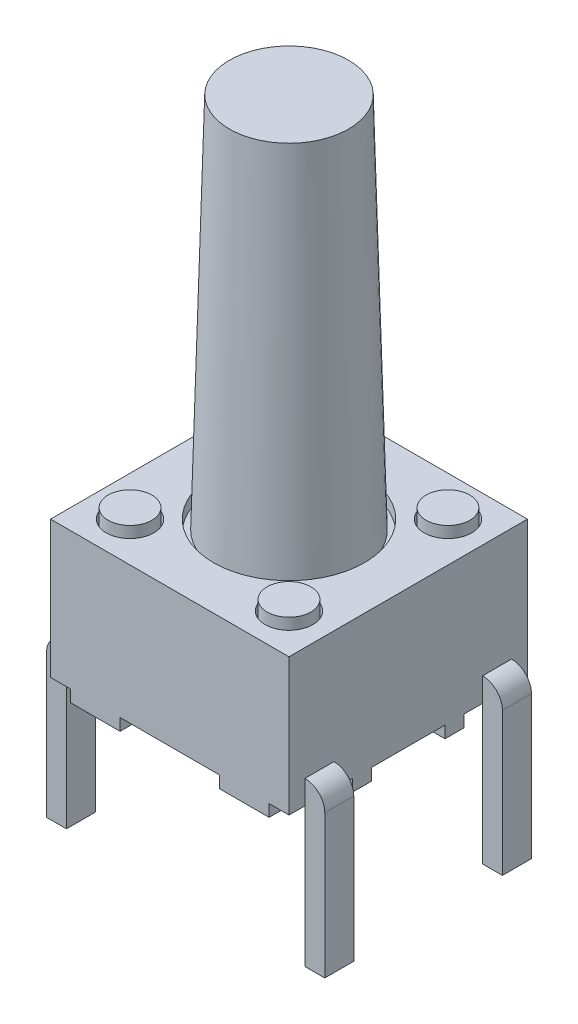
from build123d import *

# Parameters (mm, degrees)
SKETCH1_W                  = 6
SKETCH1_H                  = 6
BOSS_EXTRUDE1_DEPTH        = 3.45
SKETCH2_W                  = 6
SKETCH2_H                  = 6
SKETCH2_R                  = 0.6
SKETCH2_R_2                = 1.9
BOSS_EXTRUDE2_DEPTH        = 0.3
SKETCH3_R                  = 0.55
BOSS_EXTRUDE3_DEPTH        = 0.55
SKETCH5_W                  = 2.5
SKETCH5_H                  = 1.6
SKETCH5_W_2                = 6
SKETCH5_H_2                = 1.85
SKETCH5_W_3                = 0.5
CUT_EXTRUDE1_DEPTH         = 0.3
BOSS_EXTRUDE4_DEPTH        = 3.5
BOSS_EXTRUDE4_DEPTH_BACK   = 0.6
SKETCH6_W                  = 0.5
SKETCH6_H                  = 0.73
BOSS_EXTRUDE4_2_DEPTH      = 3.5
BOSS_EXTRUDE4_2_DEPTH_BACK = 0.6
BOSS_EXTRUDE4_3_DEPTH      = 3.5
BOSS_EXTRUDE4_3_DEPTH_BACK = 0.6
BOSS_EXTRUDE4_4_DEPTH      = 3.5
BOSS_EXTRUDE4_4_DEPTH_BACK = 0.6
FILLET1_R                  = 0.5
FILLET2_R                  = 0.5
FILLET3_R                  = 0.5
FILLET4_R                  = 0.5


with BuildPart() as part:
    # Sketch1 → Boss-Extrude1 (new body)
    with BuildSketch(Plane(origin=(0, 0, 0), x_dir=(1, 0, 0), z_dir=(0, 1, 0))):
        Rectangle(SKETCH1_W, SKETCH1_H)
    extrude(amount=BOSS_EXTRUDE1_DEPTH)



with BuildPart() as body_2:
    # Sketch2 → Boss-Extrude2 (new body)
    with BuildSketch(Plane(origin=(0, 3.45, 0), x_dir=(1, 0, 0), z_dir=(0, 1, 0))):
        Rectangle(SKETCH2_W, SKETCH2_H)
        with Locations(Location((-2, 2, 0), (0, 0, 270))):
            Circle(SKETCH2_R, mode=Mode.SUBTRACT)
        with Locations(Location((2, 2, 0), (0, 0, 270))):
            Circle(SKETCH2_R, mode=Mode.SUBTRACT)
        with Locations(Location((2, -2, 0), (0, 0, 270))):
            Circle(SKETCH2_R, mode=Mode.SUBTRACT)
        with Locations(Location((-2, -2, 0), (0, 0, 270))):
            Circle(SKETCH2_R, mode=Mode.SUBTRACT)
        with Locations(Location((0, 0, 0), (0, 0, 270))):
            Circle(SKETCH2_R_2, mode=Mode.SUBTRACT)
    extrude(amount=BOSS_EXTRUDE2_DEPTH)


with BuildPart() as part_1:
    add(part.part)

    add(body_2.part)  # Boss-Extrude3 merges body 2
    # Sketch3 → Boss-Extrude3 (add)
    with BuildSketch(Plane(origin=(0, 3.45, 0), x_dir=(1, 0, 0), z_dir=(0, 1, 0))):
        with Locations(Location((-2, 2, 0), (0, 0, 270))):
            Circle(SKETCH3_R)
        with Locations(Location((-2, -2, 0), (0, 0, 270))):
            Circle(SKETCH3_R)
        with Locations(Location((2, 2, 0), (0, 0, 270))):
            Circle(SKETCH3_R)
        with Locations(Location((2, -2, 0), (0, 0, 270))):
            Circle(SKETCH3_R)
    extrude(amount=BOSS_EXTRUDE3_DEPTH)

    # Sketch5 → Cut-Extrude1 (cut)
    with BuildSketch(Plane.XZ):
        with Locations((0, 2.2)):
            Rectangle(SKETCH5_W, SKETCH5_H)
        Rectangle(SKETCH5_W_2, SKETCH5_H_2)
        with Locations((-2.75, 2.2)):
            Rectangle(SKETCH5_W_3, SKETCH5_H)
        with Locations((2.75, 2.2)):
            Rectangle(SKETCH5_W_3, SKETCH5_H)
        with Locations((2.75, -2.2)):
            Rectangle(SKETCH5_W_3, SKETCH5_H)
        with Locations((-2.75, -2.2)):
            Rectangle(SKETCH5_W_3, SKETCH5_H)
        with Locations((0, -2.2)):
            Rectangle(SKETCH5_W, SKETCH5_H)
    extrude(amount=-CUT_EXTRUDE1_DEPTH, mode=Mode.SUBTRACT)


with BuildPart() as body_2_2:
    # Sketch4 → Revolve1 (revolve)
    with BuildSketch(Plane.XY, mode=Mode.PRIVATE) as revolve1_sk:
        Polygon((0, 13), (-1.5, 13), (-1.75, 3.506112458), (0, 3.506112458), align=None)
    revolve(revolve1_sk.sketch.rotate(Axis((0, 0, 0), (0, 1, 0)), 270), axis=Axis((0, 0, 0), (0, 1, 0)))


with BuildPart() as body_3:
    # Sketch6 → Boss-Extrude4 (new, two sides: drawn at the far end of the back side and taken through both)
    with BuildSketch(Plane.XZ.offset(-0.3).offset(-BOSS_EXTRUDE4_DEPTH_BACK)):
        with Locations((-3.25, 2.235)):
            Rectangle(SKETCH6_W, SKETCH6_H)
    extrude(amount=BOSS_EXTRUDE4_DEPTH + BOSS_EXTRUDE4_DEPTH_BACK)

    # Fillet1
    fillet1_edges = [body_3.edges().sort_by_distance(p)[0] for p in [
        (-3.5, 0.9, 2.235),
    ]]
    fillet(fillet1_edges, radius=FILLET1_R - 0.0001)  # a hair under: the kernel refuses the full size


with BuildPart() as body_4:
    # Sketch6 → Boss-Extrude4 2 (new, two sides: drawn at the far end of the back side and taken through both)
    with BuildSketch(Plane.XZ.offset(-0.3).offset(-BOSS_EXTRUDE4_2_DEPTH_BACK)):
        with Locations((3.25, 2.235)):
            Rectangle(SKETCH6_W, SKETCH6_H)
    extrude(amount=BOSS_EXTRUDE4_2_DEPTH + BOSS_EXTRUDE4_2_DEPTH_BACK)

    # Fillet3
    fillet3_edges = [body_4.edges().sort_by_distance(p)[0] for p in [
        (3.5, 0.9, 2.235),
    ]]
    fillet(fillet3_edges, radius=FILLET3_R - 0.0001)  # a hair under: the kernel refuses the full size


with BuildPart() as body_5:
    # Sketch6 → Boss-Extrude4 3 (new, two sides: drawn at the far end of the back side and taken through both)
    with BuildSketch(Plane.XZ.offset(-0.3).offset(-BOSS_EXTRUDE4_3_DEPTH_BACK)):
        with Locations((3.25, -2.235)):
            Rectangle(SKETCH6_W, SKETCH6_H)
    extrude(amount=BOSS_EXTRUDE4_3_DEPTH + BOSS_EXTRUDE4_3_DEPTH_BACK)

    # Fillet4
    fillet4_edges = [body_5.edges().sort_by_distance(p)[0] for p in [
        (3.5, 0.9, -2.235),
    ]]
    fillet(fillet4_edges, radius=FILLET4_R - 0.0001)  # a hair under: the kernel refuses the full size


with BuildPart() as body_6:
    # Sketch6 → Boss-Extrude4 4 (new, two sides: drawn at the far end of the back side and taken through both)
    with BuildSketch(Plane.XZ.offset(-0.3).offset(-BOSS_EXTRUDE4_4_DEPTH_BACK)):
        with Locations((-3.25, -2.235)):
            Rectangle(SKETCH6_W, SKETCH6_H)
    extrude(amount=BOSS_EXTRUDE4_4_DEPTH + BOSS_EXTRUDE4_4_DEPTH_BACK)

    # Fillet2
    fillet2_edges = [body_6.edges().sort_by_distance(p)[0] for p in [
        (-3.5, 0.9, -2.235),
    ]]
    fillet(fillet2_edges, radius=FILLET2_R - 0.0001)  # a hair under: the kernel refuses the full size


solid = Compound([part_1.part, body_2_2.part, body_3.part, body_4.part, body_5.part, body_6.part])
